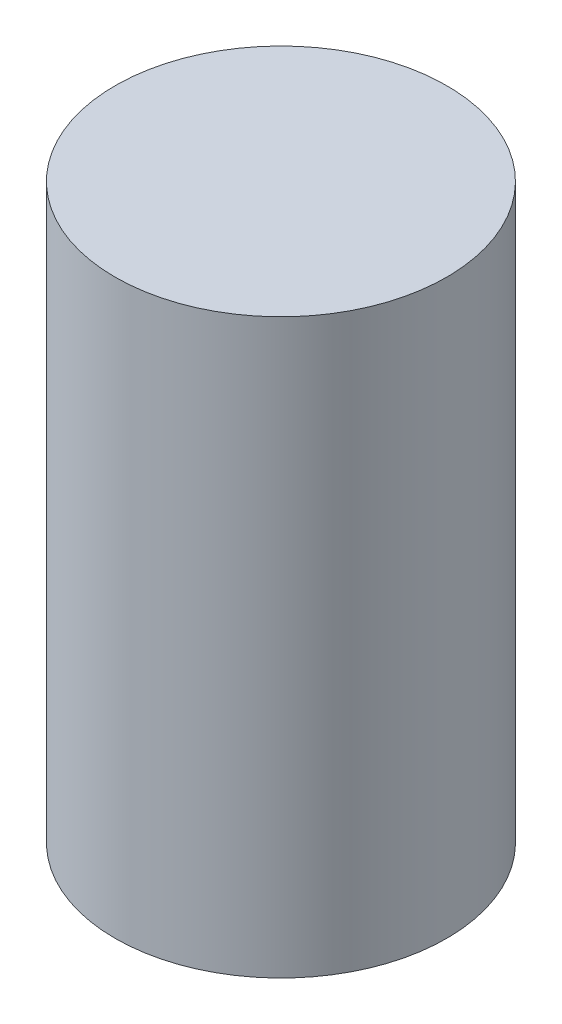
from build123d import *

# Parameters (mm, degrees)
SKETCH2_R           = 6.95
BOSS_EXTRUDE1_DEPTH = 24


with BuildPart() as part:
    # Sketch2 → Boss-Extrude1 (new body)
    with BuildSketch(Plane(origin=(0, 0, 0), x_dir=(1, 0, 0), z_dir=(0, 1, 0))):
        Circle(SKETCH2_R)
    extrude(amount=BOSS_EXTRUDE1_DEPTH)


solid = part.part
